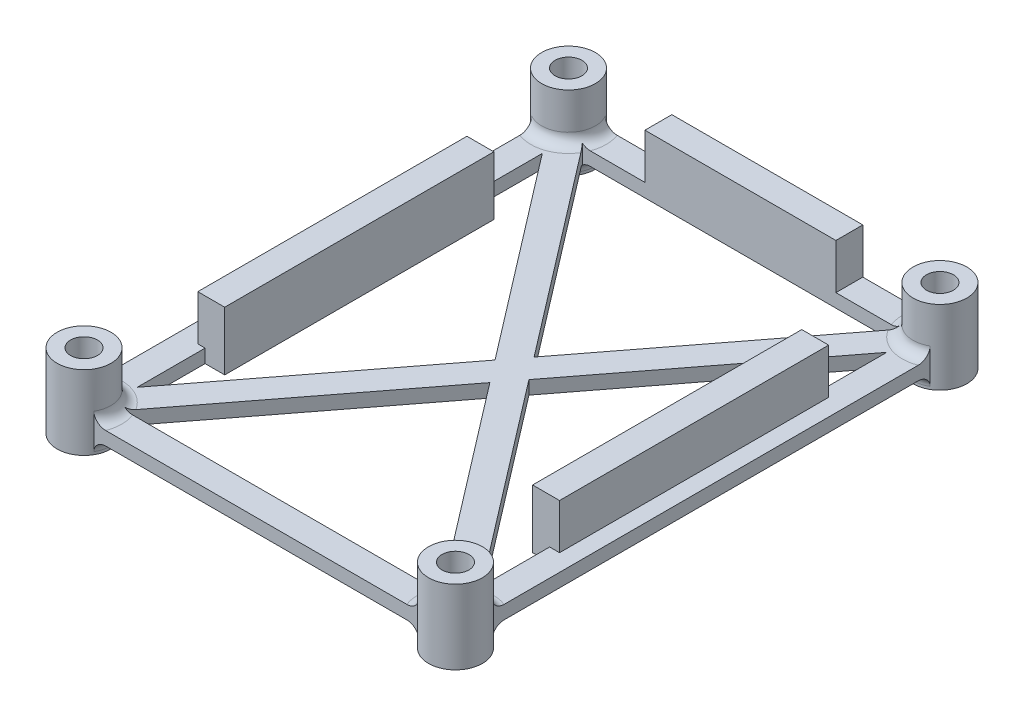
from build123d import *

# Parameters (mm, degrees)
MASS_DEPTH           = 1.5875
STANDOFFS_DEPTH      = 5.588
STANDOFFS_DEPTH_BACK = 3.175
SKETCH2_R            = 3.175
SKETCH3_R            = 1.5875
F_4_40_HOLES_DEPTH   = 42.496691663
REINFORCEMENT_R      = 1.27
WALLS_DEPTH          = 5.334
WALLS_DEPTH_BACK     = 1.5875
SKETCH4_W            = 3.175
SKETCH4_H            = 31.75
SKETCH4_W_2          = 22.526551586
SKETCH4_H_2          = 3.175


# Read off the part's stored shape, not the designer's step: Mass
with BuildPart() as part:
    # Mass outline → Mass (new body)
    with BuildSketch(Plane(origin=(0, 0, 0), x_dir=(1, 0, 0), z_dir=(0, 1, 0))):
        Polygon((23.3425, 28.58), (21.755, 28.58), (21.755, 30.1675), (-22.06, 30.1675), (-22.06, 28.58), (-23.6475, 28.58), (-23.6475, -28.57), (-22.06, -28.57), (-22.06, -30.1575), (21.755, -30.1575), (21.755, -28.57), (23.3425, -28.57), align=None)
        Polygon((-18.842554677, -26.9825), (-0.1525, -2.604167813), (18.537554677, -26.9825), align=None, mode=Mode.SUBTRACT)
        Polygon((-20.4725, 23.900180013), (-2.15286199, 0.005), (-20.4725, -23.890180013), align=None, mode=Mode.SUBTRACT)
        Polygon((-18.842554677, 26.9925), (18.537554677, 26.9925), (-0.1525, 2.614167813), align=None, mode=Mode.SUBTRACT)
        Polygon((1.84786199, 0.005), (20.1675, 23.900180013), (20.1675, -23.890180013), align=None, mode=Mode.SUBTRACT)
    extrude(amount=MASS_DEPTH)

    # Sketch2 → Standoffs (add, two sides: drawn at the far end of the back side and taken through both)
    with BuildSketch(Plane(origin=(0, 1.5875, 0), x_dir=(1, 0, 0), z_dir=(0, 1, 0)).offset(-STANDOFFS_DEPTH_BACK)):
        with Locations(Location((-22.06, -28.57, 0), (0, 0, 270))):
            Circle(SKETCH2_R)
        with Locations(Location((21.755, -28.57, 0), (0, 0, 270))):
            Circle(SKETCH2_R)
        with Locations(Location((21.755, 28.58, 0), (0, 0, 270))):
            Circle(SKETCH2_R)
        with Locations(Location((-22.06, 28.58, 0), (0, 0, 270))):
            Circle(SKETCH2_R)
    extrude(amount=STANDOFFS_DEPTH + STANDOFFS_DEPTH_BACK)

    # Sketch3 → 4-40 holes (cut, through all)
    with BuildSketch(Plane(origin=(0, 7.1755, 0), x_dir=(1, 0, 0), z_dir=(0, 1, 0))):
        with Locations(Location((-22.06, -28.57, 0), (0, 0, 270))):
            Circle(SKETCH3_R)
        with Locations(Location((21.755, -28.57, 0), (0, 0, 270))):
            Circle(SKETCH3_R)
        with Locations(Location((21.755, 28.58, 0), (0, 0, 270))):
            Circle(SKETCH3_R)
        with Locations(Location((-22.06, 28.58, 0), (0, 0, 270))):
            Circle(SKETCH3_R)
    extrude(amount=-F_4_40_HOLES_DEPTH, mode=Mode.SUBTRACT)

    # Reinforcement
    # the kernel refuses this fillet: 1.27 mm, written as the material it adds along each edge
    with BuildSketch(Plane(origin=(-22.06, 0, 28.57), x_dir=(0.04606483023853277, 0, 0.9989384522657515), z_dir=(-0.9989384522657515, 0, 0.04606483023853277))) as reinforcement_piece_1_section:
        with BuildLine():
            CenterArc((3.175 + REINFORCEMENT_R, -REINFORCEMENT_R), REINFORCEMENT_R, 90, 90)
            Line((3.175, -REINFORCEMENT_R), (3.175, 0))
            Line((3.175, 0), (3.175 + REINFORCEMENT_R, 0))
        make_face()
    reinforcement_piece_1 = revolve(axis=Axis((-22.06, 0, 28.57), (0, 1, 0)), revolution_arc=264.71949065, mode=Mode.PRIVATE)
    reinforcement_piece_1 = split(reinforcement_piece_1, bisect_by=Plane(origin=(-18.70450756, -0.27978395, 30.1575), z_dir=(0, 0, -1)), keep=Keep.TOP, mode=Mode.PRIVATE)
    reinforcement_piece_1 = split(reinforcement_piece_1, bisect_by=Plane(origin=(-19.601323313, -0.27978395, 27.97219822), z_dir=(0.7936063612872004, 0, 0.6084315436632863)), keep=Keep.TOP, mode=Mode.PRIVATE)
    reinforcement_piece_1 = split(reinforcement_piece_1, bisect_by=Plane(origin=(-18.70450756, -0.27978395, 26.9825), z_dir=(0, 0, 1)), keep=Keep.TOP, mode=Mode.PRIVATE)
    add(reinforcement_piece_1)
    with BuildSketch(Plane(origin=(-22.06, 0, 28.57), x_dir=(0.04606483023853277, 0, 0.9989384522657515), z_dir=(-0.9989384522657515, 0, 0.04606483023853277))) as reinforcement_piece_2_section:
        with BuildLine():
            CenterArc((3.175 + REINFORCEMENT_R, -REINFORCEMENT_R), REINFORCEMENT_R, 90, 90)
            Line((3.175, -REINFORCEMENT_R), (3.175, 0))
            Line((3.175, 0), (3.175 + REINFORCEMENT_R, 0))
        make_face()
    reinforcement_piece_2 = revolve(axis=Axis((-22.06, 0, 28.57), (0, 1, 0)), revolution_arc=264.71949065, mode=Mode.PRIVATE)
    reinforcement_piece_2 = split(reinforcement_piece_2, bisect_by=Plane(origin=(-23.6475, -0.429316689, 27.126130292), z_dir=(1, 0, 0)), keep=Keep.TOP, mode=Mode.PRIVATE)
    reinforcement_piece_2 = split(reinforcement_piece_2, bisect_by=Plane(origin=(-19.019669619, -0.429316689, 27.21351949), z_dir=(-0.7936063612872004, 0, -0.6084315436632863)), keep=Keep.TOP, mode=Mode.PRIVATE)
    reinforcement_piece_2 = split(reinforcement_piece_2, bisect_by=Plane(origin=(-19.13365553, -0.429316689, 26.9825), z_dir=(0, 0, 1)), keep=Keep.TOP, mode=Mode.PRIVATE)
    add(reinforcement_piece_2)
    with BuildSketch(Plane(origin=(-22.06, 0, 28.57), x_dir=(0.04606483023853277, 0, 0.9989384522657515), z_dir=(-0.9989384522657515, 0, 0.04606483023853277))) as reinforcement_piece_3_section:
        with BuildLine():
            CenterArc((3.175 + REINFORCEMENT_R, -REINFORCEMENT_R), REINFORCEMENT_R, 90, 90)
            Line((3.175, -REINFORCEMENT_R), (3.175, 0))
            Line((3.175, 0), (3.175 + REINFORCEMENT_R, 0))
        make_face()
    reinforcement_piece_3 = revolve(axis=Axis((-22.06, 0, 28.57), (0, 1, 0)), revolution_arc=264.71949065, mode=Mode.PRIVATE)
    reinforcement_piece_3 = split(reinforcement_piece_3, bisect_by=Plane(origin=(-23.6475, -0.362764324, 25.184463901), z_dir=(1, 0, 0)), keep=Keep.TOP, mode=Mode.PRIVATE)
    reinforcement_piece_3 = split(reinforcement_piece_3, bisect_by=Plane(origin=(-18.785387858, -0.362764324, 26.907934585), z_dir=(-0.7936063612872004, 0, -0.6084315436632863)), keep=Keep.TOP, mode=Mode.PRIVATE)
    reinforcement_piece_3 = split(reinforcement_piece_3, bisect_by=Plane(origin=(-21.033393098, -0.362764324, 26.9825), z_dir=(0, 0, -1)), keep=Keep.TOP, mode=Mode.PRIVATE)
    add(reinforcement_piece_3)
    with BuildSketch(Plane(origin=(-22.06, 1.5875, 28.57), x_dir=(0.046064830238519316, 0, 0.9989384522657521), z_dir=(-0.9989384522657521, 0, 0.046064830238519316))) as reinforcement_piece_4_section:
        with BuildLine():
            CenterArc((3.175 + REINFORCEMENT_R, REINFORCEMENT_R), REINFORCEMENT_R, 180, 90)
            Line((3.175, REINFORCEMENT_R), (3.175, 0))
            Line((3.175, 0), (3.175 + REINFORCEMENT_R, 0))
        make_face()
    reinforcement_piece_4 = revolve(axis=Axis((-22.06, 1.5875, 28.57), (0, 1, 0)), revolution_arc=264.71949065, mode=Mode.PRIVATE)
    reinforcement_piece_4 = split(reinforcement_piece_4, bisect_by=Plane(origin=(-18.70450756, 1.86728395, 30.1575), z_dir=(0, 0, -1)), keep=Keep.TOP, mode=Mode.PRIVATE)
    reinforcement_piece_4 = split(reinforcement_piece_4, bisect_by=Plane(origin=(-19.601323313, 1.86728395, 27.97219822), z_dir=(0.7936063612872004, 0, 0.6084315436632863)), keep=Keep.TOP, mode=Mode.PRIVATE)
    reinforcement_piece_4 = split(reinforcement_piece_4, bisect_by=Plane(origin=(-18.70450756, 1.86728395, 26.9825), z_dir=(0, 0, 1)), keep=Keep.TOP, mode=Mode.PRIVATE)
    add(reinforcement_piece_4)
    with BuildSketch(Plane(origin=(-22.06, 1.5875, 28.57), x_dir=(0.046064830238519316, 0, 0.9989384522657521), z_dir=(-0.9989384522657521, 0, 0.046064830238519316))) as reinforcement_piece_5_section:
        with BuildLine():
            CenterArc((3.175 + REINFORCEMENT_R, REINFORCEMENT_R), REINFORCEMENT_R, 180, 90)
            Line((3.175, REINFORCEMENT_R), (3.175, 0))
            Line((3.175, 0), (3.175 + REINFORCEMENT_R, 0))
        make_face()
    reinforcement_piece_5 = revolve(axis=Axis((-22.06, 1.5875, 28.57), (0, 1, 0)), revolution_arc=264.71949065, mode=Mode.PRIVATE)
    reinforcement_piece_5 = split(reinforcement_piece_5, bisect_by=Plane(origin=(-23.6475, 2.016816689, 27.126130292), z_dir=(1, 0, 0)), keep=Keep.TOP, mode=Mode.PRIVATE)
    reinforcement_piece_5 = split(reinforcement_piece_5, bisect_by=Plane(origin=(-19.019669619, 2.016816689, 27.21351949), z_dir=(-0.7936063612872004, 0, -0.6084315436632863)), keep=Keep.TOP, mode=Mode.PRIVATE)
    reinforcement_piece_5 = split(reinforcement_piece_5, bisect_by=Plane(origin=(-19.13365553, 2.016816689, 26.9825), z_dir=(0, 0, 1)), keep=Keep.TOP, mode=Mode.PRIVATE)
    add(reinforcement_piece_5)
    with BuildSketch(Plane(origin=(-22.06, 1.5875, 28.57), x_dir=(0.046064830238519316, 0, 0.9989384522657521), z_dir=(-0.9989384522657521, 0, 0.046064830238519316))) as reinforcement_piece_6_section:
        with BuildLine():
            CenterArc((3.175 + REINFORCEMENT_R, REINFORCEMENT_R), REINFORCEMENT_R, 180, 90)
            Line((3.175, REINFORCEMENT_R), (3.175, 0))
            Line((3.175, 0), (3.175 + REINFORCEMENT_R, 0))
        make_face()
    reinforcement_piece_6 = revolve(axis=Axis((-22.06, 1.5875, 28.57), (0, 1, 0)), revolution_arc=264.71949065, mode=Mode.PRIVATE)
    reinforcement_piece_6 = split(reinforcement_piece_6, bisect_by=Plane(origin=(-23.6475, 1.950264324, 25.184463901), z_dir=(1, 0, 0)), keep=Keep.TOP, mode=Mode.PRIVATE)
    reinforcement_piece_6 = split(reinforcement_piece_6, bisect_by=Plane(origin=(-18.785387858, 1.950264324, 26.907934585), z_dir=(-0.7936063612872004, 0, -0.6084315436632863)), keep=Keep.TOP, mode=Mode.PRIVATE)
    reinforcement_piece_6 = split(reinforcement_piece_6, bisect_by=Plane(origin=(-21.033393098, 1.950264324, 26.9825), z_dir=(0, 0, -1)), keep=Keep.TOP, mode=Mode.PRIVATE)
    add(reinforcement_piece_6)
    with BuildSketch(Plane(origin=(21.755, 1.5875, 28.57), x_dir=(0.9989384522657526, 0, -0.04606483023851039), z_dir=(0.04606483023851039, 0, 0.9989384522657526))) as reinforcement_piece_7_section:
        with BuildLine():
            CenterArc((3.175 + REINFORCEMENT_R, REINFORCEMENT_R), REINFORCEMENT_R, 180, 90)
            Line((3.175, REINFORCEMENT_R), (3.175, 0))
            Line((3.175, 0), (3.175 + REINFORCEMENT_R, 0))
        make_face()
    reinforcement_piece_7 = revolve(axis=Axis((21.755, 1.5875, 28.57), (0, 1, 0)), revolution_arc=264.71949065, mode=Mode.PRIVATE)
    reinforcement_piece_7 = split(reinforcement_piece_7, bisect_by=Plane(origin=(23.3425, 1.950264323, 25.184463901), z_dir=(-1, 0, 0)), keep=Keep.TOP, mode=Mode.PRIVATE)
    reinforcement_piece_7 = split(reinforcement_piece_7, bisect_by=Plane(origin=(20.728393099, 1.950264323, 26.9825), z_dir=(0, 0, -1)), keep=Keep.TOP, mode=Mode.PRIVATE)
    reinforcement_piece_7 = split(reinforcement_piece_7, bisect_by=Plane(origin=(18.480387859, 1.950264323, 26.907934585), z_dir=(0.7936063612872004, 0, -0.6084315436632863)), keep=Keep.TOP, mode=Mode.PRIVATE)
    add(reinforcement_piece_7)
    with BuildSketch(Plane(origin=(21.755, 1.5875, 28.57), x_dir=(0.9989384522657526, 0, -0.04606483023851039), z_dir=(0.04606483023851039, 0, 0.9989384522657526))) as reinforcement_piece_8_section:
        with BuildLine():
            CenterArc((3.175 + REINFORCEMENT_R, REINFORCEMENT_R), REINFORCEMENT_R, 180, 90)
            Line((3.175, REINFORCEMENT_R), (3.175, 0))
            Line((3.175, 0), (3.175 + REINFORCEMENT_R, 0))
        make_face()
    reinforcement_piece_8 = revolve(axis=Axis((21.755, 1.5875, 28.57), (0, 1, 0)), revolution_arc=264.71949065, mode=Mode.PRIVATE)
    reinforcement_piece_8 = split(reinforcement_piece_8, bisect_by=Plane(origin=(23.3425, 2.016816689, 27.126130289), z_dir=(-1, 0, 0)), keep=Keep.TOP, mode=Mode.PRIVATE)
    reinforcement_piece_8 = split(reinforcement_piece_8, bisect_by=Plane(origin=(18.828655532, 2.016816689, 26.9825), z_dir=(0, 0, 1)), keep=Keep.TOP, mode=Mode.PRIVATE)
    reinforcement_piece_8 = split(reinforcement_piece_8, bisect_by=Plane(origin=(18.714669618, 2.016816689, 27.213519489), z_dir=(0.7936063612872004, 0, -0.6084315436632863)), keep=Keep.TOP, mode=Mode.PRIVATE)
    add(reinforcement_piece_8)
    with BuildSketch(Plane(origin=(21.755, 1.5875, 28.57), x_dir=(0.9989384522657526, 0, -0.04606483023851039), z_dir=(0.04606483023851039, 0, 0.9989384522657526))) as reinforcement_piece_9_section:
        with BuildLine():
            CenterArc((3.175 + REINFORCEMENT_R, REINFORCEMENT_R), REINFORCEMENT_R, 180, 90)
            Line((3.175, REINFORCEMENT_R), (3.175, 0))
            Line((3.175, 0), (3.175 + REINFORCEMENT_R, 0))
        make_face()
    reinforcement_piece_9 = revolve(axis=Axis((21.755, 1.5875, 28.57), (0, 1, 0)), revolution_arc=264.71949065, mode=Mode.PRIVATE)
    reinforcement_piece_9 = split(reinforcement_piece_9, bisect_by=Plane(origin=(18.399507543, 1.867283937, 30.1575), z_dir=(0, 0, -1)), keep=Keep.TOP, mode=Mode.PRIVATE)
    reinforcement_piece_9 = split(reinforcement_piece_9, bisect_by=Plane(origin=(18.399507543, 1.867283937, 26.9825), z_dir=(0, 0, 1)), keep=Keep.TOP, mode=Mode.PRIVATE)
    reinforcement_piece_9 = split(reinforcement_piece_9, bisect_by=Plane(origin=(19.296322906, 1.867283937, 27.97219769), z_dir=(-0.7936063612872004, 0, 0.6084315436632863)), keep=Keep.TOP, mode=Mode.PRIVATE)
    add(reinforcement_piece_9)
    with BuildSketch(Plane(origin=(21.755, 0, 28.57), x_dir=(0.9989384522657522, 0, -0.046064830238518206), z_dir=(0.046064830238518206, 0, 0.9989384522657522))) as reinforcement_piece_10_section:
        with BuildLine():
            CenterArc((3.175 + REINFORCEMENT_R, -REINFORCEMENT_R), REINFORCEMENT_R, 90, 90)
            Line((3.175, -REINFORCEMENT_R), (3.175, 0))
            Line((3.175, 0), (3.175 + REINFORCEMENT_R, 0))
        make_face()
    reinforcement_piece_10 = revolve(axis=Axis((21.755, 0, 28.57), (0, 1, 0)), revolution_arc=264.71949065, mode=Mode.PRIVATE)
    reinforcement_piece_10 = split(reinforcement_piece_10, bisect_by=Plane(origin=(23.3425, -0.362764323, 25.184463901), z_dir=(-1, 0, 0)), keep=Keep.TOP, mode=Mode.PRIVATE)
    reinforcement_piece_10 = split(reinforcement_piece_10, bisect_by=Plane(origin=(20.728393099, -0.362764323, 26.9825), z_dir=(0, 0, -1)), keep=Keep.TOP, mode=Mode.PRIVATE)
    reinforcement_piece_10 = split(reinforcement_piece_10, bisect_by=Plane(origin=(18.480387859, -0.362764323, 26.907934585), z_dir=(0.7936063612872004, 0, -0.6084315436632863)), keep=Keep.TOP, mode=Mode.PRIVATE)
    add(reinforcement_piece_10)
    with BuildSketch(Plane(origin=(21.755, 0, 28.57), x_dir=(0.9989384522657522, 0, -0.046064830238518206), z_dir=(0.046064830238518206, 0, 0.9989384522657522))) as reinforcement_piece_11_section:
        with BuildLine():
            CenterArc((3.175 + REINFORCEMENT_R, -REINFORCEMENT_R), REINFORCEMENT_R, 90, 90)
            Line((3.175, -REINFORCEMENT_R), (3.175, 0))
            Line((3.175, 0), (3.175 + REINFORCEMENT_R, 0))
        make_face()
    reinforcement_piece_11 = revolve(axis=Axis((21.755, 0, 28.57), (0, 1, 0)), revolution_arc=264.71949065, mode=Mode.PRIVATE)
    reinforcement_piece_11 = split(reinforcement_piece_11, bisect_by=Plane(origin=(23.3425, -0.429316689, 27.126130289), z_dir=(-1, 0, 0)), keep=Keep.TOP, mode=Mode.PRIVATE)
    reinforcement_piece_11 = split(reinforcement_piece_11, bisect_by=Plane(origin=(18.828655532, -0.429316689, 26.9825), z_dir=(0, 0, 1)), keep=Keep.TOP, mode=Mode.PRIVATE)
    reinforcement_piece_11 = split(reinforcement_piece_11, bisect_by=Plane(origin=(18.714669618, -0.429316689, 27.213519489), z_dir=(0.7936063612872004, 0, -0.6084315436632863)), keep=Keep.TOP, mode=Mode.PRIVATE)
    add(reinforcement_piece_11)
    with BuildSketch(Plane(origin=(21.755, 0, 28.57), x_dir=(0.9989384522657522, 0, -0.046064830238518206), z_dir=(0.046064830238518206, 0, 0.9989384522657522))) as reinforcement_piece_12_section:
        with BuildLine():
            CenterArc((3.175 + REINFORCEMENT_R, -REINFORCEMENT_R), REINFORCEMENT_R, 90, 90)
            Line((3.175, -REINFORCEMENT_R), (3.175, 0))
            Line((3.175, 0), (3.175 + REINFORCEMENT_R, 0))
        make_face()
    reinforcement_piece_12 = revolve(axis=Axis((21.755, 0, 28.57), (0, 1, 0)), revolution_arc=264.71949065, mode=Mode.PRIVATE)
    reinforcement_piece_12 = split(reinforcement_piece_12, bisect_by=Plane(origin=(18.399507543, -0.279783937, 30.1575), z_dir=(0, 0, -1)), keep=Keep.TOP, mode=Mode.PRIVATE)
    reinforcement_piece_12 = split(reinforcement_piece_12, bisect_by=Plane(origin=(18.399507543, -0.279783937, 26.9825), z_dir=(0, 0, 1)), keep=Keep.TOP, mode=Mode.PRIVATE)
    reinforcement_piece_12 = split(reinforcement_piece_12, bisect_by=Plane(origin=(19.296322906, -0.279783937, 27.97219769), z_dir=(-0.7936063612872004, 0, 0.6084315436632863)), keep=Keep.TOP, mode=Mode.PRIVATE)
    add(reinforcement_piece_12)
    with BuildSketch(Plane(origin=(21.755, 1.5875, -28.58), x_dir=(-0.04646650962963982, 0, -0.9989198483776557), z_dir=(0.9989198483776557, 0, -0.04646650962963982))) as reinforcement_piece_13_section:
        with BuildLine():
            CenterArc((3.175 + REINFORCEMENT_R, REINFORCEMENT_R), REINFORCEMENT_R, 180, 90)
            Line((3.175, REINFORCEMENT_R), (3.175, 0))
            Line((3.175, 0), (3.175 + REINFORCEMENT_R, 0))
        make_face()
    reinforcement_piece_13 = revolve(axis=Axis((21.755, 1.5875, -28.58), (0, 1, 0)), revolution_arc=177.33670612, mode=Mode.PRIVATE)
    reinforcement_piece_13 = split(reinforcement_piece_13, bisect_by=Plane(origin=(18.39950756, 1.86728395, -30.1675), z_dir=(0, 0, 1)), keep=Keep.TOP, mode=Mode.PRIVATE)
    reinforcement_piece_13 = split(reinforcement_piece_13, bisect_by=Plane(origin=(18.39950756, 1.86728395, -26.9925), z_dir=(0, 0, -1)), keep=Keep.TOP, mode=Mode.PRIVATE)
    reinforcement_piece_13 = split(reinforcement_piece_13, bisect_by=Plane(origin=(19.296323313, 1.86728395, -27.98219822), z_dir=(-0.7936063612872005, 0, -0.6084315436632866)), keep=Keep.TOP, mode=Mode.PRIVATE)
    add(reinforcement_piece_13)
    with BuildSketch(Plane(origin=(21.755, 1.5875, -28.58), x_dir=(-0.04646650962963982, 0, -0.9989198483776557), z_dir=(0.9989198483776557, 0, -0.04646650962963982))) as reinforcement_piece_14_section:
        with BuildLine():
            CenterArc((3.175 + REINFORCEMENT_R, REINFORCEMENT_R), REINFORCEMENT_R, 180, 90)
            Line((3.175, REINFORCEMENT_R), (3.175, 0))
            Line((3.175, 0), (3.175 + REINFORCEMENT_R, 0))
        make_face()
    reinforcement_piece_14 = revolve(axis=Axis((21.755, 1.5875, -28.58), (0, 1, 0)), revolution_arc=177.33670612, mode=Mode.PRIVATE)
    reinforcement_piece_14 = split(reinforcement_piece_14, bisect_by=Plane(origin=(18.82865553, 2.016816689, -26.9925), z_dir=(0, 0, -1)), keep=Keep.TOP, mode=Mode.PRIVATE)
    reinforcement_piece_14 = split(reinforcement_piece_14, bisect_by=Plane(origin=(18.714669619, 2.016816689, -27.22351949), z_dir=(0.7936063612872005, 0, 0.6084315436632866)), keep=Keep.TOP, mode=Mode.PRIVATE)
    add(reinforcement_piece_14)
    with BuildSketch(Plane(origin=(21.755, 1.5875, -28.58), x_dir=(-0.04646650962963982, 0, -0.9989198483776557), z_dir=(0.9989198483776557, 0, -0.04646650962963982))) as reinforcement_piece_15_section:
        with BuildLine():
            CenterArc((3.175 + REINFORCEMENT_R, REINFORCEMENT_R), REINFORCEMENT_R, 180, 90)
            Line((3.175, REINFORCEMENT_R), (3.175, 0))
            Line((3.175, 0), (3.175 + REINFORCEMENT_R, 0))
        make_face()
    reinforcement_piece_15 = revolve(axis=Axis((21.755, 1.5875, -28.58), (0, 1, 0)), revolution_arc=177.33670612, mode=Mode.PRIVATE)
    reinforcement_piece_15 = split(reinforcement_piece_15, bisect_by=Plane(origin=(20.054539855, 1.860329305, -26.9925), z_dir=(0, 0, 1)), keep=Keep.TOP, mode=Mode.PRIVATE)
    reinforcement_piece_15 = split(reinforcement_piece_15, bisect_by=Plane(origin=(18.489174162, 1.860329305, -26.92939498), z_dir=(0.7936063612872005, 0, 0.6084315436632866)), keep=Keep.TOP, mode=Mode.PRIVATE)
    add(reinforcement_piece_15)
    with BuildSketch(Plane(origin=(21.755, 0, -28.58), x_dir=(-0.04646650962968236, 0, -0.9989198483776537), z_dir=(0.9989198483776537, 0, -0.04646650962968236))) as reinforcement_piece_16_section:
        with BuildLine():
            CenterArc((3.175 + REINFORCEMENT_R, -REINFORCEMENT_R), REINFORCEMENT_R, 90, 90)
            Line((3.175, -REINFORCEMENT_R), (3.175, 0))
            Line((3.175, 0), (3.175 + REINFORCEMENT_R, 0))
        make_face()
    reinforcement_piece_16 = revolve(axis=Axis((21.755, 0, -28.58), (0, 1, 0)), revolution_arc=177.33670612, mode=Mode.PRIVATE)
    reinforcement_piece_16 = split(reinforcement_piece_16, bisect_by=Plane(origin=(18.39950756, -0.27978395, -30.1675), z_dir=(0, 0, 1)), keep=Keep.TOP, mode=Mode.PRIVATE)
    reinforcement_piece_16 = split(reinforcement_piece_16, bisect_by=Plane(origin=(18.39950756, -0.27978395, -26.9925), z_dir=(0, 0, -1)), keep=Keep.TOP, mode=Mode.PRIVATE)
    reinforcement_piece_16 = split(reinforcement_piece_16, bisect_by=Plane(origin=(19.296323313, -0.27978395, -27.98219822), z_dir=(-0.7936063612872005, 0, -0.6084315436632866)), keep=Keep.TOP, mode=Mode.PRIVATE)
    add(reinforcement_piece_16)
    with BuildSketch(Plane(origin=(21.755, 0, -28.58), x_dir=(-0.04646650962968236, 0, -0.9989198483776537), z_dir=(0.9989198483776537, 0, -0.04646650962968236))) as reinforcement_piece_17_section:
        with BuildLine():
            CenterArc((3.175 + REINFORCEMENT_R, -REINFORCEMENT_R), REINFORCEMENT_R, 90, 90)
            Line((3.175, -REINFORCEMENT_R), (3.175, 0))
            Line((3.175, 0), (3.175 + REINFORCEMENT_R, 0))
        make_face()
    reinforcement_piece_17 = revolve(axis=Axis((21.755, 0, -28.58), (0, 1, 0)), revolution_arc=177.33670612, mode=Mode.PRIVATE)
    reinforcement_piece_17 = split(reinforcement_piece_17, bisect_by=Plane(origin=(18.82865553, -0.429316689, -26.9925), z_dir=(0, 0, -1)), keep=Keep.TOP, mode=Mode.PRIVATE)
    reinforcement_piece_17 = split(reinforcement_piece_17, bisect_by=Plane(origin=(18.714669619, -0.429316689, -27.22351949), z_dir=(0.7936063612872005, 0, 0.6084315436632866)), keep=Keep.TOP, mode=Mode.PRIVATE)
    add(reinforcement_piece_17)
    with BuildSketch(Plane(origin=(21.755, 0, -28.58), x_dir=(-0.04646650962968236, 0, -0.9989198483776537), z_dir=(0.9989198483776537, 0, -0.04646650962968236))) as reinforcement_piece_18_section:
        with BuildLine():
            CenterArc((3.175 + REINFORCEMENT_R, -REINFORCEMENT_R), REINFORCEMENT_R, 90, 90)
            Line((3.175, -REINFORCEMENT_R), (3.175, 0))
            Line((3.175, 0), (3.175 + REINFORCEMENT_R, 0))
        make_face()
    reinforcement_piece_18 = revolve(axis=Axis((21.755, 0, -28.58), (0, 1, 0)), revolution_arc=177.33670612, mode=Mode.PRIVATE)
    reinforcement_piece_18 = split(reinforcement_piece_18, bisect_by=Plane(origin=(20.054539855, -0.272829305, -26.9925), z_dir=(0, 0, 1)), keep=Keep.TOP, mode=Mode.PRIVATE)
    reinforcement_piece_18 = split(reinforcement_piece_18, bisect_by=Plane(origin=(18.489174162, -0.272829305, -26.92939498), z_dir=(0.7936063612872005, 0, 0.6084315436632866)), keep=Keep.TOP, mode=Mode.PRIVATE)
    add(reinforcement_piece_18)
    with BuildSketch(Plane(origin=(-22.06, 1.5875, -28.58), x_dir=(0, 0, 1), z_dir=(-1, 0, 0))) as reinforcement_piece_19_section:
        with BuildLine():
            CenterArc((3.175 + REINFORCEMENT_R, REINFORCEMENT_R), REINFORCEMENT_R, 180, 90)
            Line((3.175, REINFORCEMENT_R), (3.175, 0))
            Line((3.175, 0), (3.175 + REINFORCEMENT_R, 0))
        make_face()
    reinforcement_piece_19 = revolve(axis=Axis((-22.06, 1.5875, -28.58), (0, 1, 0)), revolution_arc=177.33670612, mode=Mode.PRIVATE)
    reinforcement_piece_19 = split(reinforcement_piece_19, bisect_by=Plane(origin=(-20.359539923, 1.860329213, -26.9925), z_dir=(0, 0, 1)), keep=Keep.TOP, mode=Mode.PRIVATE)
    reinforcement_piece_19 = split(reinforcement_piece_19, bisect_by=Plane(origin=(-18.794173873, 1.860329213, -26.929394604), z_dir=(-0.7936063612872005, 0, 0.6084315436632866)), keep=Keep.TOP, mode=Mode.PRIVATE)
    add(reinforcement_piece_19)
    with BuildSketch(Plane(origin=(-22.06, 1.5875, -28.58), x_dir=(0, 0, 1), z_dir=(-1, 0, 0))) as reinforcement_piece_20_section:
        with BuildLine():
            CenterArc((3.175 + REINFORCEMENT_R, REINFORCEMENT_R), REINFORCEMENT_R, 180, 90)
            Line((3.175, REINFORCEMENT_R), (3.175, 0))
            Line((3.175, 0), (3.175 + REINFORCEMENT_R, 0))
        make_face()
    reinforcement_piece_20 = revolve(axis=Axis((-22.06, 1.5875, -28.58), (0, 1, 0)), revolution_arc=177.33670612, mode=Mode.PRIVATE)
    reinforcement_piece_20 = split(reinforcement_piece_20, bisect_by=Plane(origin=(-19.133655532, 2.016816689, -26.9925), z_dir=(0, 0, -1)), keep=Keep.TOP, mode=Mode.PRIVATE)
    reinforcement_piece_20 = split(reinforcement_piece_20, bisect_by=Plane(origin=(-19.019669618, 2.016816689, -27.223519489), z_dir=(-0.7936063612872005, 0, 0.6084315436632866)), keep=Keep.TOP, mode=Mode.PRIVATE)
    add(reinforcement_piece_20)
    with BuildSketch(Plane(origin=(-22.06, 1.5875, -28.58), x_dir=(0, 0, 1), z_dir=(-1, 0, 0))) as reinforcement_piece_21_section:
        with BuildLine():
            CenterArc((3.175 + REINFORCEMENT_R, REINFORCEMENT_R), REINFORCEMENT_R, 180, 90)
            Line((3.175, REINFORCEMENT_R), (3.175, 0))
            Line((3.175, 0), (3.175 + REINFORCEMENT_R, 0))
        make_face()
    reinforcement_piece_21 = revolve(axis=Axis((-22.06, 1.5875, -28.58), (0, 1, 0)), revolution_arc=177.33670612, mode=Mode.PRIVATE)
    reinforcement_piece_21 = split(reinforcement_piece_21, bisect_by=Plane(origin=(-18.704507543, 1.867283937, -30.1675), z_dir=(0, 0, 1)), keep=Keep.TOP, mode=Mode.PRIVATE)
    reinforcement_piece_21 = split(reinforcement_piece_21, bisect_by=Plane(origin=(-18.704507543, 1.867283937, -26.9925), z_dir=(0, 0, -1)), keep=Keep.TOP, mode=Mode.PRIVATE)
    reinforcement_piece_21 = split(reinforcement_piece_21, bisect_by=Plane(origin=(-19.601322906, 1.867283937, -27.98219769), z_dir=(0.7936063612872005, 0, -0.6084315436632866)), keep=Keep.TOP, mode=Mode.PRIVATE)
    add(reinforcement_piece_21)
    with BuildSketch(Plane(origin=(-22.06, 0, -28.58), x_dir=(0, 0, 1), z_dir=(-1, 0, 0))) as reinforcement_piece_22_section:
        with BuildLine():
            CenterArc((3.175 + REINFORCEMENT_R, -REINFORCEMENT_R), REINFORCEMENT_R, 90, 90)
            Line((3.175, -REINFORCEMENT_R), (3.175, 0))
            Line((3.175, 0), (3.175 + REINFORCEMENT_R, 0))
        make_face()
    reinforcement_piece_22 = revolve(axis=Axis((-22.06, 0, -28.58), (0, 1, 0)), revolution_arc=177.33670612, mode=Mode.PRIVATE)
    reinforcement_piece_22 = split(reinforcement_piece_22, bisect_by=Plane(origin=(-20.359539923, -0.272829213, -26.9925), z_dir=(0, 0, 1)), keep=Keep.TOP, mode=Mode.PRIVATE)
    reinforcement_piece_22 = split(reinforcement_piece_22, bisect_by=Plane(origin=(-18.794173873, -0.272829213, -26.929394604), z_dir=(-0.7936063612872005, 0, 0.6084315436632866)), keep=Keep.TOP, mode=Mode.PRIVATE)
    add(reinforcement_piece_22)
    with BuildSketch(Plane(origin=(-22.06, 0, -28.58), x_dir=(0, 0, 1), z_dir=(-1, 0, 0))) as reinforcement_piece_23_section:
        with BuildLine():
            CenterArc((3.175 + REINFORCEMENT_R, -REINFORCEMENT_R), REINFORCEMENT_R, 90, 90)
            Line((3.175, -REINFORCEMENT_R), (3.175, 0))
            Line((3.175, 0), (3.175 + REINFORCEMENT_R, 0))
        make_face()
    reinforcement_piece_23 = revolve(axis=Axis((-22.06, 0, -28.58), (0, 1, 0)), revolution_arc=177.33670612, mode=Mode.PRIVATE)
    reinforcement_piece_23 = split(reinforcement_piece_23, bisect_by=Plane(origin=(-19.133655532, -0.429316689, -26.9925), z_dir=(0, 0, -1)), keep=Keep.TOP, mode=Mode.PRIVATE)
    reinforcement_piece_23 = split(reinforcement_piece_23, bisect_by=Plane(origin=(-19.019669618, -0.429316689, -27.223519489), z_dir=(-0.7936063612872005, 0, 0.6084315436632866)), keep=Keep.TOP, mode=Mode.PRIVATE)
    add(reinforcement_piece_23)
    with BuildSketch(Plane(origin=(-22.06, 0, -28.58), x_dir=(0, 0, 1), z_dir=(-1, 0, 0))) as reinforcement_piece_24_section:
        with BuildLine():
            CenterArc((3.175 + REINFORCEMENT_R, -REINFORCEMENT_R), REINFORCEMENT_R, 90, 90)
            Line((3.175, -REINFORCEMENT_R), (3.175, 0))
            Line((3.175, 0), (3.175 + REINFORCEMENT_R, 0))
        make_face()
    reinforcement_piece_24 = revolve(axis=Axis((-22.06, 0, -28.58), (0, 1, 0)), revolution_arc=177.33670612, mode=Mode.PRIVATE)
    reinforcement_piece_24 = split(reinforcement_piece_24, bisect_by=Plane(origin=(-18.704507543, -0.279783937, -30.1675), z_dir=(0, 0, 1)), keep=Keep.TOP, mode=Mode.PRIVATE)
    reinforcement_piece_24 = split(reinforcement_piece_24, bisect_by=Plane(origin=(-18.704507543, -0.279783937, -26.9925), z_dir=(0, 0, -1)), keep=Keep.TOP, mode=Mode.PRIVATE)
    reinforcement_piece_24 = split(reinforcement_piece_24, bisect_by=Plane(origin=(-19.601322906, -0.279783937, -27.98219769), z_dir=(0.7936063612872005, 0, -0.6084315436632866)), keep=Keep.TOP, mode=Mode.PRIVATE)
    add(reinforcement_piece_24)
    with BuildSketch(Plane(origin=(-22.06, 0, -28.58), x_dir=(-0.9988885066492684, 0, 0.04713545676021855), z_dir=(-0.04713545676021855, 0, -0.9988885066492684))) as reinforcement_piece_25_section:
        with BuildLine():
            CenterArc((3.175 + REINFORCEMENT_R, -REINFORCEMENT_R), REINFORCEMENT_R, 90, 90)
            Line((3.175, -REINFORCEMENT_R), (3.175, 0))
            Line((3.175, 0), (3.175 + REINFORCEMENT_R, 0))
        make_face()
    reinforcement_piece_25 = revolve(axis=Axis((-22.06, 0, -28.58), (0, 1, 0)), revolution_arc=87.298336228, mode=Mode.PRIVATE)
    reinforcement_piece_25 = split(reinforcement_piece_25, bisect_by=Plane(origin=(-23.6475, -0.288535561, -25.249624151), z_dir=(1, 0, 0)), keep=Keep.TOP, mode=Mode.PRIVATE)
    add(reinforcement_piece_25)
    with BuildSketch(Plane(origin=(-22.06, 1.5875, -28.58), x_dir=(-0.998888506649268, 0, 0.04713545676022753), z_dir=(-0.04713545676022753, 0, -0.998888506649268))) as reinforcement_piece_26_section:
        with BuildLine():
            CenterArc((3.175 + REINFORCEMENT_R, REINFORCEMENT_R), REINFORCEMENT_R, 180, 90)
            Line((3.175, REINFORCEMENT_R), (3.175, 0))
            Line((3.175, 0), (3.175 + REINFORCEMENT_R, 0))
        make_face()
    reinforcement_piece_26 = revolve(axis=Axis((-22.06, 1.5875, -28.58), (0, 1, 0)), revolution_arc=87.298336228, mode=Mode.PRIVATE)
    reinforcement_piece_26 = split(reinforcement_piece_26, bisect_by=Plane(origin=(-23.6475, 1.876035561, -25.249624151), z_dir=(1, 0, 0)), keep=Keep.TOP, mode=Mode.PRIVATE)
    add(reinforcement_piece_26)
    with BuildSketch(Plane(origin=(21.755, 0, -28.58), x_dir=(0, 0, 1), z_dir=(-1, 0, 0))) as reinforcement_piece_27_section:
        with BuildLine():
            CenterArc((3.175 + REINFORCEMENT_R, -REINFORCEMENT_R), REINFORCEMENT_R, 90, 90)
            Line((3.175, -REINFORCEMENT_R), (3.175, 0))
            Line((3.175, 0), (3.175 + REINFORCEMENT_R, 0))
        make_face()
    reinforcement_piece_27 = revolve(axis=Axis((21.755, 0, -28.58), (0, 1, 0)), revolution_arc=87.298336228, mode=Mode.PRIVATE)
    reinforcement_piece_27 = split(reinforcement_piece_27, bisect_by=Plane(origin=(23.3425, -0.288535492, -25.24962386), z_dir=(-1, 0, 0)), keep=Keep.TOP, mode=Mode.PRIVATE)
    add(reinforcement_piece_27)
    with BuildSketch(Plane(origin=(21.755, 1.5875, -28.58), x_dir=(0, 0, 1), z_dir=(-1, 0, 0))) as reinforcement_piece_28_section:
        with BuildLine():
            CenterArc((3.175 + REINFORCEMENT_R, REINFORCEMENT_R), REINFORCEMENT_R, 180, 90)
            Line((3.175, REINFORCEMENT_R), (3.175, 0))
            Line((3.175, 0), (3.175 + REINFORCEMENT_R, 0))
        make_face()
    reinforcement_piece_28 = revolve(axis=Axis((21.755, 1.5875, -28.58), (0, 1, 0)), revolution_arc=87.298336228, mode=Mode.PRIVATE)
    reinforcement_piece_28 = split(reinforcement_piece_28, bisect_by=Plane(origin=(23.3425, 1.876035492, -25.24962386), z_dir=(-1, 0, 0)), keep=Keep.TOP, mode=Mode.PRIVATE)
    add(reinforcement_piece_28)

    # Sketch4 → Walls (add, two sides: drawn at the far end of the back side and taken through both)
    with BuildSketch(Plane(origin=(0, 1.5875, 0), x_dir=(1, 0, 0), z_dir=(0, 1, 0)).offset(-WALLS_DEPTH_BACK)):
        with Locations((19.7485, 0)):
            Rectangle(SKETCH4_W, SKETCH4_H)
        with Locations((-19.7485, 0)):
            Rectangle(SKETCH4_W, SKETCH4_H)
        with Locations((-0.194250889, 28.58)):
            Rectangle(SKETCH4_W_2, SKETCH4_H_2)
    extrude(amount=WALLS_DEPTH + WALLS_DEPTH_BACK)


solid = part.part
